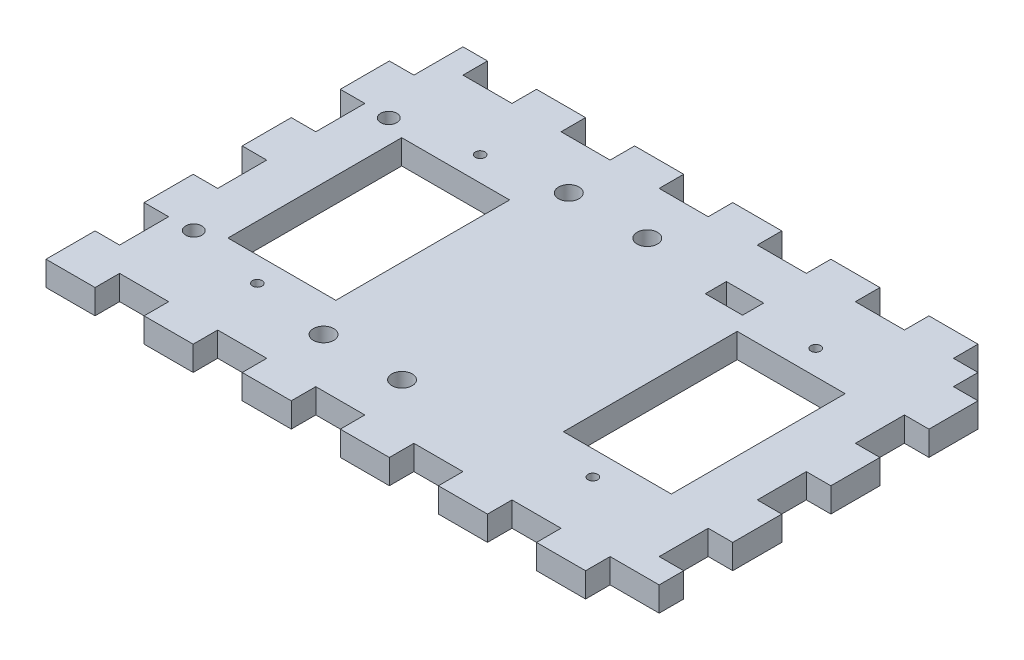
from build123d import *

# Parameters (mm, degrees)
SKETCH1_W                   = 152.4
SKETCH1_H                   = 101.6
BOSS_EXTRUDE2_DEPTH         = 6.35
SKETCH2_W                   = 6.35
SKETCH2_H                   = 12.7
CUT_EXTRUDE2_DEPTH          = 6.35
SKETCH2_4_W                 = 12.7
SKETCH2_4_H                 = 6.35
CUT_EXTRUDE3_DEPTH          = 6.35
SKETCH9_W                   = 27.94
SKETCH9_H                   = 45
CUT_EXTRUDE4_DEPTH          = 184.272045059
TAP_DRILL_FOR_M3X0_5_TAP1_D = 2.5
TAP_DRILL_FOR_M5X0_8_TAP1_D = 4.2
M5_CLEARANCE_HOLE4_D        = 5.3
SKETCH55_W                  = 9.652
SKETCH55_H                  = 5.461
CUT_EXTRUDE9_DEPTH          = 184.272045059


with BuildPart() as part:
    # Sketch1 → Boss-Extrude2 (new body)
    with BuildSketch(Plane(origin=(0, 0, 0), x_dir=(1, 0, 0), z_dir=(0, 1, 0))):
        with Locations((76.2, 50.8)):
            Rectangle(SKETCH1_W, SKETCH1_H)
    extrude(amount=BOSS_EXTRUDE2_DEPTH)

    # Sketch2 → Cut-Extrude2 (cut)
    with BuildSketch(Plane(origin=(0, 6.35, 0), x_dir=(1, 0, 0), z_dir=(0, 1, 0))):
        with Locations((3.175, 95.25)):
            Rectangle(SKETCH2_W, SKETCH2_H)
        with Locations((3.175, 69.85)):
            Rectangle(SKETCH2_W, SKETCH2_H)
        with Locations((3.175, 44.45)):
            Rectangle(SKETCH2_W, SKETCH2_H)
        with Locations((3.175, 19.05)):
            Rectangle(SKETCH2_W, SKETCH2_H)
    cut_extrude2 = extrude(amount=-CUT_EXTRUDE2_DEPTH, mode=Mode.SUBTRACT)

    # Mirror1: Cut-Extrude2 across plane
    add(cut_extrude2.mirror(Plane.ZY.offset(-76.2)), mode=Mode.SUBTRACT)

    # Sketch2<4> → Cut-Extrude3 (cut)
    with BuildSketch(Plane(origin=(0, 6.35, 0), x_dir=(1, 0, 0), z_dir=(0, 1, 0))):
        with Locations((19.05, 98.425)):
            Rectangle(SKETCH2_4_W, SKETCH2_4_H)
        with Locations((44.45, 98.425)):
            Rectangle(SKETCH2_4_W, SKETCH2_4_H)
        with Locations((69.85, 98.425)):
            Rectangle(SKETCH2_4_W, SKETCH2_4_H)
        with Locations((95.25, 98.425)):
            Rectangle(SKETCH2_4_W, SKETCH2_4_H)
        with Locations((146.05, 98.425)):
            Rectangle(SKETCH2_4_W, SKETCH2_4_H)
        with Locations((120.65, 98.425)):
            Rectangle(SKETCH2_4_W, SKETCH2_4_H)
    cut_extrude3 = extrude(amount=-CUT_EXTRUDE3_DEPTH, mode=Mode.SUBTRACT)

    # Mirror2: Cut-Extrude3 across plane
    add(cut_extrude3.mirror(Plane(origin=(0, 0, -50.8), x_dir=(1, 0, 0), z_dir=(0, 0, -1))), mode=Mode.SUBTRACT)

    # Sketch9 → Cut-Extrude4 (cut, through all)
    with BuildSketch(Plane(origin=(0, 6.35, 0), x_dir=(1, 0, 0), z_dir=(0, 1, 0))):
        with Locations((32.766, 50.8)):
            Rectangle(SKETCH9_W, SKETCH9_H)
        with Locations((119.634, 50.8)):
            Rectangle(SKETCH9_W, SKETCH9_H)
    extrude(amount=-CUT_EXTRUDE4_DEPTH, mode=Mode.SUBTRACT)

    # Tap Drill for M3x0.5 Tap1 (through all)
    with Locations(Plane(origin=(0, 6.35, 0), x_dir=(1, 0, 0), z_dir=(0, 1, 0))):
        with Locations((32.766, 79.65), (32.766, 21.95), (119.634, 21.95), (119.634, 79.65)):
            Hole(TAP_DRILL_FOR_M3X0_5_TAP1_D / 2)

    # Tap Drill for M5x0.8 Tap1 (through all)
    with Locations(Plane(origin=(0, 6.35, 0), x_dir=(1, 0, 0), z_dir=(0, 1, 0))):
        with Locations((12.7, 76.04), (12.7, 25.56)):
            Hole(TAP_DRILL_FOR_M5X0_8_TAP1_D / 2)

    # M5 Clearance Hole4 (through all)
    with Locations(Plane(origin=(0, 0, 0), x_dir=(-1, 0, 0), z_dir=(0, -1, 0))):
        with Locations((-73.126, 82.55), (-52.806, 82.55), (-73.126, 19.05), (-52.806, 19.05)):
            Hole(M5_CLEARANCE_HOLE4_D / 2)

    # Sketch55 → Cut-Extrude9 (cut, through all)
    with BuildSketch(Plane(origin=(0, 6.35, 0), x_dir=(1, 0, 0), z_dir=(0, 1, 0))):
        with Locations((97.90684, 80.3402)):
            Rectangle(SKETCH55_W, SKETCH55_H)
    extrude(amount=-CUT_EXTRUDE9_DEPTH, mode=Mode.SUBTRACT)


solid = part.part
